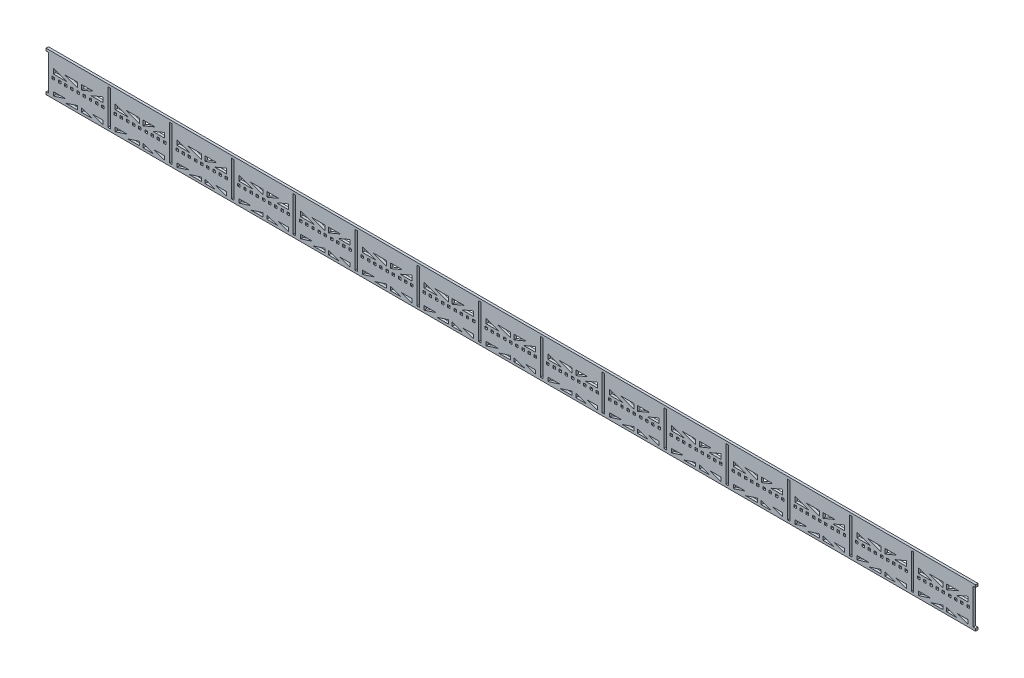
from build123d import *

# Parameters (mm, degrees)
BOSS_EXTRUDE1_DEPTH = 4
BOSS_EXTRUDE2_START = -4
BOSS_EXTRUDE2_DEPTH = 4
SKETCH5_W           = 4
SKETCH5_H           = 4
CUT_EXTRUDE1_DEPTH  = 10


# Read off the part's stored shape, not the designer's step: Boss-Extrude1
with BuildPart() as part:
    # Boss-Extrude1 outline → Boss-Extrude1 (new body)
    with BuildSketch(Plane.XY):
        Polygon((721.508397322, 1.805025961), (721.508397322, 40.020025961), (725.508397322, 40.020025961), (725.508397322, 44.020025961), (-778.491602678, 44.020025961), (-778.491602678, 40.020025961), (-774.491602678, 40.020025961), (-774.491602678, 1.805025961), (-750.491602678, 1.805025961), (-756.491602678, 9.805025961), (-732.491602678, 9.805025961), (-738.491602678, 1.805025961), (-714.491602678, 1.805025961), (-720.491602678, 9.805025961), (-696.491602678, 9.805025961), (-702.491602678, 1.805025961), (-678.491602678, 1.805025961), (-678.491602678, 40.020025961), (-674.491602678, 40.020025961), (-674.491602678, 1.805025961), (-650.491602678, 1.805025961), (-656.491602678, 9.805025961), (-632.491602678, 9.805025961), (-638.491602678, 1.805025961), (-614.491602678, 1.805025961), (-620.491602678, 9.805025961), (-596.491602678, 9.805025961), (-602.491602678, 1.805025961), (-578.491602678, 1.805025961), (-578.491602678, 40.020025961), (-574.491602678, 40.020025961), (-574.491602678, 1.805025961), (-550.491602678, 1.805025961), (-556.491602678, 9.805025961), (-532.491602678, 9.805025961), (-538.491602678, 1.805025961), (-514.491602678, 1.805025961), (-520.491602678, 9.805025961), (-496.491602678, 9.805025961), (-502.491602678, 1.805025961), (-478.491602678, 1.805025961), (-478.491602678, 40.020025961), (-474.491602678, 40.020025961), (-474.491602678, 1.805025961), (-450.491602678, 1.805025961), (-456.491602678, 9.805025961), (-432.491602678, 9.805025961), (-438.491602678, 1.805025961), (-414.491602678, 1.805025961), (-420.491602678, 9.805025961), (-396.491602678, 9.805025961), (-402.491602678, 1.805025961), (-378.491602678, 1.805025961), (-378.491602678, 40.020025961), (-374.491602678, 40.020025961), (-374.491602678, 1.805025961), (-350.491602678, 1.805025961), (-356.491602678, 9.805025961), (-332.491602678, 9.805025961), (-338.491602678, 1.805025961), (-314.491602678, 1.805025961), (-320.491602678, 9.805025961), (-296.491602678, 9.805025961), (-302.491602678, 1.805025961), (-278.491602678, 1.805025961), (-278.491602678, 40.020025961), (-274.491602678, 40.020025961), (-274.491602678, 1.805025961), (-250.491602678, 1.805025961), (-256.491602678, 9.805025961), (-232.491602678, 9.805025961), (-238.491602678, 1.805025961), (-214.491602678, 1.805025961), (-220.491602678, 9.805025961), (-196.491602678, 9.805025961), (-202.491602678, 1.805025961), (-178.491602678, 1.805025961), (-178.491602678, 40.020025961), (-174.491602678, 40.020025961), (-174.491602678, 1.805025961), (-150.491602678, 1.805025961), (-156.491602678, 9.805025961), (-132.491602678, 9.805025961), (-138.491602678, 1.805025961), (-114.491602678, 1.805025961), (-120.491602678, 9.805025961), (-96.491602678, 9.805025961), (-102.491602678, 1.805025961), (-78.491602678, 1.805025961), (-78.491602678, 40.020025961), (-74.491602678, 40.020025961), (-74.491602678, 1.805025961), (-50.491602678, 1.805025961), (-56.491602678, 9.805025961), (-32.491602678, 9.805025961), (-38.491602678, 1.805025961), (-14.491602678, 1.805025961), (-20.491602678, 9.805025961), (3.508397322, 9.805025961), (-2.491602678, 1.805025961), (21.508397322, 1.805025961), (21.508397322, 40.020025961), (25.508397322, 40.020025961), (25.508397322, 1.805025961), (49.508397322, 1.805025961), (43.508397322, 9.805025961), (67.508397322, 9.805025961), (61.508397322, 1.805025961), (85.508397322, 1.805025961), (79.508397322, 9.805025961), (103.508397322, 9.805025961), (97.508397322, 1.805025961), (121.508397322, 1.805025961), (121.508397322, 40.020025961), (125.508397322, 40.020025961), (125.508397322, 1.805025961), (149.508397322, 1.805025961), (143.508397322, 9.805025961), (167.508397322, 9.805025961), (161.508397322, 1.805025961), (185.508397322, 1.805025961), (179.508397322, 9.805025961), (203.508397322, 9.805025961), (197.508397322, 1.805025961), (221.508397322, 1.805025961), (221.508397322, 40.020025961), (225.508397322, 40.020025961), (225.508397322, 1.805025961), (249.508397322, 1.805025961), (243.508397322, 9.805025961), (267.508397322, 9.805025961), (261.508397322, 1.805025961), (285.508397322, 1.805025961), (279.508397322, 9.805025961), (303.508397322, 9.805025961), (297.508397322, 1.805025961), (321.508397322, 1.805025961), (321.508397322, 40.020025961), (325.508397322, 40.020025961), (325.508397322, 1.805025961), (349.508397322, 1.805025961), (343.508397322, 9.805025961), (367.508397322, 9.805025961), (361.508397322, 1.805025961), (385.508397322, 1.805025961), (379.508397322, 9.805025961), (403.508397322, 9.805025961), (397.508397322, 1.805025961), (421.508397322, 1.805025961), (421.508397322, 40.020025961), (425.508397322, 40.020025961), (425.508397322, 1.805025961), (449.508397322, 1.805025961), (443.508397322, 9.805025961), (467.508397322, 9.805025961), (461.508397322, 1.805025961), (485.508397322, 1.805025961), (479.508397322, 9.805025961), (503.508397322, 9.805025961), (497.508397322, 1.805025961), (521.508397322, 1.805025961), (521.508397322, 40.020025961), (525.508397322, 40.020025961), (525.508397322, 1.805025961), (549.508397322, 1.805025961), (543.508397322, 9.805025961), (567.508397322, 9.805025961), (561.508397322, 1.805025961), (585.508397322, 1.805025961), (579.508397322, 9.805025961), (603.508397322, 9.805025961), (597.508397322, 1.805025961), (621.508397322, 1.805025961), (621.508397322, 40.020025961), (625.508397322, 40.020025961), (625.508397322, 1.805025961), (649.508397322, 1.805025961), (643.508397322, 9.805025961), (667.508397322, 9.805025961), (661.508397322, 1.805025961), (685.508397322, 1.805025961), (679.508397322, 9.805025961), (703.508397322, 9.805025961), (697.508397322, 1.805025961), align=None)
    extrude(amount=BOSS_EXTRUDE1_DEPTH)

    # Sketch3 → Boss-Extrude2 (add)
    with BuildSketch(Plane.XY.offset(4).offset(BOSS_EXTRUDE2_START)):
        Polygon((-774.491602678, 1.805025961), (-774.491602678, -17.134974039), (-778.491602678, -17.134974039), (-778.491602678, -21.134974039), (725.508397322, -21.134974039), (725.508397322, -17.134974039), (721.508397322, -17.134974039), (721.508397322, 1.805025961), (697.508397322, 1.805025961), (703.508397322, 9.805025961), (679.508397322, 9.805025961), (685.508397322, 1.805025961), (661.508397322, 1.805025961), (667.508397322, 9.805025961), (643.508397322, 9.805025961), (649.508397322, 1.805025961), (625.508397322, 1.805025961), (625.508397322, -17.134974039), (621.508397322, -17.134974039), (621.508397322, 1.805025961), (597.508397322, 1.805025961), (603.508397322, 9.805025961), (579.508397322, 9.805025961), (585.508397322, 1.805025961), (561.508397322, 1.805025961), (567.508397322, 9.805025961), (543.508397322, 9.805025961), (549.508397322, 1.805025961), (525.508397322, 1.805025961), (525.508397322, -17.134974039), (521.508397322, -17.134974039), (521.508397322, 1.805025961), (497.508397322, 1.805025961), (503.508397322, 9.805025961), (479.508397322, 9.805025961), (485.508397322, 1.805025961), (461.508397322, 1.805025961), (467.508397322, 9.805025961), (443.508397322, 9.805025961), (449.508397322, 1.805025961), (425.508397322, 1.805025961), (425.508397322, -17.134974039), (421.508397322, -17.134974039), (421.508397322, 1.805025961), (397.508397322, 1.805025961), (403.508397322, 9.805025961), (379.508397322, 9.805025961), (385.508397322, 1.805025961), (361.508397322, 1.805025961), (367.508397322, 9.805025961), (343.508397322, 9.805025961), (349.508397322, 1.805025961), (325.508397322, 1.805025961), (325.508397322, -17.134974039), (321.508397322, -17.134974039), (321.508397322, 1.805025961), (297.508397322, 1.805025961), (303.508397322, 9.805025961), (279.508397322, 9.805025961), (285.508397322, 1.805025961), (261.508397322, 1.805025961), (267.508397322, 9.805025961), (243.508397322, 9.805025961), (249.508397322, 1.805025961), (225.508397322, 1.805025961), (225.508397322, -17.134974039), (221.508397322, -17.134974039), (221.508397322, 1.805025961), (197.508397322, 1.805025961), (203.508397322, 9.805025961), (179.508397322, 9.805025961), (185.508397322, 1.805025961), (161.508397322, 1.805025961), (167.508397322, 9.805025961), (143.508397322, 9.805025961), (149.508397322, 1.805025961), (125.508397322, 1.805025961), (125.508397322, -17.134974039), (121.508397322, -17.134974039), (121.508397322, 1.805025961), (97.508397322, 1.805025961), (103.508397322, 9.805025961), (79.508397322, 9.805025961), (85.508397322, 1.805025961), (61.508397322, 1.805025961), (67.508397322, 9.805025961), (43.508397322, 9.805025961), (49.508397322, 1.805025961), (25.508397322, 1.805025961), (25.508397322, -17.134974039), (21.508397322, -17.134974039), (21.508397322, 1.805025961), (-2.491602678, 1.805025961), (3.508397322, 9.805025961), (-20.491602678, 9.805025961), (-14.491602678, 1.805025961), (-38.491602678, 1.805025961), (-32.491602678, 9.805025961), (-56.491602678, 9.805025961), (-50.491602678, 1.805025961), (-74.491602678, 1.805025961), (-74.491602678, -17.134974039), (-78.491602678, -17.134974039), (-78.491602678, 1.805025961), (-102.491602678, 1.805025961), (-96.491602678, 9.805025961), (-120.491602678, 9.805025961), (-114.491602678, 1.805025961), (-138.491602678, 1.805025961), (-132.491602678, 9.805025961), (-156.491602678, 9.805025961), (-150.491602678, 1.805025961), (-174.491602678, 1.805025961), (-174.491602678, -17.134974039), (-178.491602678, -17.134974039), (-178.491602678, 1.805025961), (-202.491602678, 1.805025961), (-196.491602678, 9.805025961), (-220.491602678, 9.805025961), (-214.491602678, 1.805025961), (-238.491602678, 1.805025961), (-232.491602678, 9.805025961), (-256.491602678, 9.805025961), (-250.491602678, 1.805025961), (-274.491602678, 1.805025961), (-274.491602678, -17.134974039), (-278.491602678, -17.134974039), (-278.491602678, 1.805025961), (-302.491602678, 1.805025961), (-296.491602678, 9.805025961), (-320.491602678, 9.805025961), (-314.491602678, 1.805025961), (-338.491602678, 1.805025961), (-332.491602678, 9.805025961), (-356.491602678, 9.805025961), (-350.491602678, 1.805025961), (-374.491602678, 1.805025961), (-374.491602678, -17.134974039), (-378.491602678, -17.134974039), (-378.491602678, 1.805025961), (-402.491602678, 1.805025961), (-396.491602678, 9.805025961), (-420.491602678, 9.805025961), (-414.491602678, 1.805025961), (-438.491602678, 1.805025961), (-432.491602678, 9.805025961), (-456.491602678, 9.805025961), (-450.491602678, 1.805025961), (-474.491602678, 1.805025961), (-474.491602678, -17.134974039), (-478.491602678, -17.134974039), (-478.491602678, 1.805025961), (-502.491602678, 1.805025961), (-496.491602678, 9.805025961), (-520.491602678, 9.805025961), (-514.491602678, 1.805025961), (-538.491602678, 1.805025961), (-532.491602678, 9.805025961), (-556.491602678, 9.805025961), (-550.491602678, 1.805025961), (-574.491602678, 1.805025961), (-574.491602678, -17.134974039), (-578.491602678, -17.134974039), (-578.491602678, 1.805025961), (-602.491602678, 1.805025961), (-596.491602678, 9.805025961), (-620.491602678, 9.805025961), (-614.491602678, 1.805025961), (-638.491602678, 1.805025961), (-632.491602678, 9.805025961), (-656.491602678, 9.805025961), (-650.491602678, 1.805025961), (-674.491602678, 1.805025961), (-674.491602678, -17.134974039), (-678.491602678, -17.134974039), (-678.491602678, 1.805025961), (-702.491602678, 1.805025961), (-696.491602678, 9.805025961), (-720.491602678, 9.805025961), (-714.491602678, 1.805025961), (-738.491602678, 1.805025961), (-732.491602678, 9.805025961), (-756.491602678, 9.805025961), (-750.491602678, 1.805025961), align=None)
    extrude(amount=BOSS_EXTRUDE2_DEPTH)

    # Sketch5 → Cut-Extrude1 (cut)
    with BuildSketch(Plane.XY.offset(4)):
        Polygon((-666.491602678, 21.805025961), (-666.491602678, 13.805025961), (-644.636037004, 13.805025961), align=None)
        Polygon((-766.491602678, 21.805025961), (-766.491602678, 13.805025961), (-744.636037004, 13.805025961), align=None)
        Polygon((-749.036317378, 21.805025961), (-727.180751703, 13.805025961), (-727.180751703, 21.805025961), align=None)
        Polygon((-721.180751703, 21.805025961), (-721.180751703, 13.805025961), (-702.046261335, 21.805025961), align=None)
        Polygon((-686.491602678, 21.805025961), (-686.491602678, 13.805025961), (-705.626093047, 13.805025961), align=None)
        Polygon((-703.629058117, -10.924974039), (-686.491602678, -17.134974039), (-686.491602678, -10.924974039), align=None)
        Polygon((-704.103103987, -17.134974039), (-721.240559425, -17.134974039), (-721.240559425, -10.924974039), align=None)
        Polygon((-727.240559425, -17.134974039), (-746.729180991, -17.134974039), (-727.240559425, -10.924974039), align=None)
        Polygon((-747.002981113, -10.924974039), (-766.491602678, -17.134974039), (-766.491602678, -10.924974039), align=None)
        Polygon((-649.036317378, 21.805025961), (-627.180751703, 13.805025961), (-627.180751703, 21.805025961), align=None)
        Polygon((-621.180751703, 21.805025961), (-621.180751703, 13.805025961), (-602.046261335, 21.805025961), align=None)
        Polygon((-586.491602678, 21.805025961), (-586.491602678, 13.805025961), (-605.626093047, 13.805025961), align=None)
        Polygon((-603.629058117, -10.924974039), (-586.491602678, -17.134974039), (-586.491602678, -10.924974039), align=None)
        Polygon((-604.103103987, -17.134974039), (-621.240559425, -17.134974039), (-621.240559425, -10.924974039), align=None)
        Polygon((-627.240559425, -17.134974039), (-646.729180991, -17.134974039), (-627.240559425, -10.924974039), align=None)
        Polygon((-647.002981113, -10.924974039), (-666.491602678, -17.134974039), (-666.491602678, -10.924974039), align=None)
        with Locations((-666.491602678, 7.755025961)):
            Rectangle(SKETCH5_W, SKETCH5_H)
        with Locations((-656.491602678, 7.755025961)):
            Rectangle(SKETCH5_W, SKETCH5_H)
        with Locations((-646.491602678, 7.755025961)):
            Rectangle(SKETCH5_W, SKETCH5_H)
        with Locations((-636.491602678, 7.755025961)):
            Rectangle(SKETCH5_W, SKETCH5_H)
        with Locations((-626.491602678, 7.755025961)):
            Rectangle(SKETCH5_W, SKETCH5_H)
        with Locations((-616.491602678, 7.755025961)):
            Rectangle(SKETCH5_W, SKETCH5_H)
        with Locations((-606.491602678, 7.755025961)):
            Rectangle(SKETCH5_W, SKETCH5_H)
        with Locations((-596.491602678, 7.755025961)):
            Rectangle(SKETCH5_W, SKETCH5_H)
        with Locations((-586.491602678, 7.755025961)):
            Rectangle(SKETCH5_W, SKETCH5_H)
        with Locations((-566.491602678, 7.755025961)):
            Rectangle(SKETCH5_W, SKETCH5_H)
        with Locations((-556.491602678, 7.755025961)):
            Rectangle(SKETCH5_W, SKETCH5_H)
        Polygon((-566.491602678, 21.805025961), (-566.491602678, 13.805025961), (-544.636037004, 13.805025961), align=None)
        Polygon((-549.036317378, 21.805025961), (-527.180751703, 13.805025961), (-527.180751703, 21.805025961), align=None)
        Polygon((-521.180751703, 21.805025961), (-521.180751703, 13.805025961), (-502.046261335, 21.805025961), align=None)
        Polygon((-486.491602678, 21.805025961), (-486.491602678, 13.805025961), (-505.626093047, 13.805025961), align=None)
        Polygon((-503.629058117, -10.924974039), (-486.491602678, -17.134974039), (-486.491602678, -10.924974039), align=None)
        Polygon((-504.103103987, -17.134974039), (-521.240559425, -17.134974039), (-521.240559425, -10.924974039), align=None)
        Polygon((-527.240559425, -17.134974039), (-546.729180991, -17.134974039), (-527.240559425, -10.924974039), align=None)
        Polygon((-547.002981113, -10.924974039), (-566.491602678, -17.134974039), (-566.491602678, -10.924974039), align=None)
        with Locations((-546.491602678, 7.755025961)):
            Rectangle(SKETCH5_W, SKETCH5_H)
        with Locations((-536.491602678, 7.755025961)):
            Rectangle(SKETCH5_W, SKETCH5_H)
        with Locations((-526.491602678, 7.755025961)):
            Rectangle(SKETCH5_W, SKETCH5_H)
        with Locations((-516.491602678, 7.755025961)):
            Rectangle(SKETCH5_W, SKETCH5_H)
        with Locations((-506.491602678, 7.755025961)):
            Rectangle(SKETCH5_W, SKETCH5_H)
        with Locations((-496.491602678, 7.755025961)):
            Rectangle(SKETCH5_W, SKETCH5_H)
        with Locations((-486.491602678, 7.755025961)):
            Rectangle(SKETCH5_W, SKETCH5_H)
        with Locations((-466.491602678, 7.755025961)):
            Rectangle(SKETCH5_W, SKETCH5_H)
        with Locations((-456.491602678, 7.755025961)):
            Rectangle(SKETCH5_W, SKETCH5_H)
        with Locations((-446.491602678, 7.755025961)):
            Rectangle(SKETCH5_W, SKETCH5_H)
        with Locations((-436.491602678, 7.755025961)):
            Rectangle(SKETCH5_W, SKETCH5_H)
        Polygon((-466.491602678, 21.805025961), (-466.491602678, 13.805025961), (-444.636037004, 13.805025961), align=None)
        Polygon((-449.036317378, 21.805025961), (-427.180751703, 13.805025961), (-427.180751703, 21.805025961), align=None)
        Polygon((-421.180751703, 21.805025961), (-421.180751703, 13.805025961), (-402.046261335, 21.805025961), align=None)
        Polygon((-386.491602678, 21.805025961), (-386.491602678, 13.805025961), (-405.626093047, 13.805025961), align=None)
        Polygon((-403.629058117, -10.924974039), (-386.491602678, -17.134974039), (-386.491602678, -10.924974039), align=None)
        Polygon((-404.103103987, -17.134974039), (-421.240559425, -17.134974039), (-421.240559425, -10.924974039), align=None)
        Polygon((-427.240559425, -17.134974039), (-446.729180991, -17.134974039), (-427.240559425, -10.924974039), align=None)
        Polygon((-447.002981113, -10.924974039), (-466.491602678, -17.134974039), (-466.491602678, -10.924974039), align=None)
        with Locations((-426.491602678, 7.755025961)):
            Rectangle(SKETCH5_W, SKETCH5_H)
        with Locations((-416.491602678, 7.755025961)):
            Rectangle(SKETCH5_W, SKETCH5_H)
        with Locations((-406.491602678, 7.755025961)):
            Rectangle(SKETCH5_W, SKETCH5_H)
        with Locations((-396.491602678, 7.755025961)):
            Rectangle(SKETCH5_W, SKETCH5_H)
        with Locations((-386.491602678, 7.755025961)):
            Rectangle(SKETCH5_W, SKETCH5_H)
        with Locations((-366.491602678, 7.755025961)):
            Rectangle(SKETCH5_W, SKETCH5_H)
        with Locations((-356.491602678, 7.755025961)):
            Rectangle(SKETCH5_W, SKETCH5_H)
        with Locations((-346.491602678, 7.755025961)):
            Rectangle(SKETCH5_W, SKETCH5_H)
        with Locations((-336.491602678, 7.755025961)):
            Rectangle(SKETCH5_W, SKETCH5_H)
        with Locations((-326.491602678, 7.755025961)):
            Rectangle(SKETCH5_W, SKETCH5_H)
        with Locations((-316.491602678, 7.755025961)):
            Rectangle(SKETCH5_W, SKETCH5_H)
        Polygon((-366.491602678, 21.805025961), (-366.491602678, 13.805025961), (-344.636037004, 13.805025961), align=None)
        Polygon((-349.036317378, 21.805025961), (-327.180751703, 13.805025961), (-327.180751703, 21.805025961), align=None)
        Polygon((-321.180751703, 21.805025961), (-321.180751703, 13.805025961), (-302.046261335, 21.805025961), align=None)
        Polygon((-286.491602678, 21.805025961), (-286.491602678, 13.805025961), (-305.626093047, 13.805025961), align=None)
        Polygon((-303.629058117, -10.924974039), (-286.491602678, -17.134974039), (-286.491602678, -10.924974039), align=None)
        Polygon((-304.103103987, -17.134974039), (-321.240559425, -17.134974039), (-321.240559425, -10.924974039), align=None)
        Polygon((-327.240559425, -17.134974039), (-346.729180991, -17.134974039), (-327.240559425, -10.924974039), align=None)
        Polygon((-347.002981113, -10.924974039), (-366.491602678, -17.134974039), (-366.491602678, -10.924974039), align=None)
        with Locations((-306.491602678, 7.755025961)):
            Rectangle(SKETCH5_W, SKETCH5_H)
        with Locations((-296.491602678, 7.755025961)):
            Rectangle(SKETCH5_W, SKETCH5_H)
        with Locations((-286.491602678, 7.755025961)):
            Rectangle(SKETCH5_W, SKETCH5_H)
        with Locations((-266.491602678, 7.755025961)):
            Rectangle(SKETCH5_W, SKETCH5_H)
        with Locations((-256.491602678, 7.755025961)):
            Rectangle(SKETCH5_W, SKETCH5_H)
        with Locations((-246.491602678, 7.755025961)):
            Rectangle(SKETCH5_W, SKETCH5_H)
        with Locations((-236.491602678, 7.755025961)):
            Rectangle(SKETCH5_W, SKETCH5_H)
        with Locations((-226.491602678, 7.755025961)):
            Rectangle(SKETCH5_W, SKETCH5_H)
        with Locations((-216.491602678, 7.755025961)):
            Rectangle(SKETCH5_W, SKETCH5_H)
        with Locations((-206.491602678, 7.755025961)):
            Rectangle(SKETCH5_W, SKETCH5_H)
        with Locations((-196.491602678, 7.755025961)):
            Rectangle(SKETCH5_W, SKETCH5_H)
        Polygon((-266.491602678, 21.805025961), (-266.491602678, 13.805025961), (-244.636037004, 13.805025961), align=None)
        Polygon((-249.036317378, 21.805025961), (-227.180751703, 13.805025961), (-227.180751703, 21.805025961), align=None)
        Polygon((-221.180751703, 21.805025961), (-221.180751703, 13.805025961), (-202.046261335, 21.805025961), align=None)
        Polygon((-186.491602678, 21.805025961), (-186.491602678, 13.805025961), (-205.626093047, 13.805025961), align=None)
        Polygon((-203.629058117, -10.924974039), (-186.491602678, -17.134974039), (-186.491602678, -10.924974039), align=None)
        Polygon((-204.103103987, -17.134974039), (-221.240559425, -17.134974039), (-221.240559425, -10.924974039), align=None)
        Polygon((-227.240559425, -17.134974039), (-246.729180991, -17.134974039), (-227.240559425, -10.924974039), align=None)
        Polygon((-247.002981113, -10.924974039), (-266.491602678, -17.134974039), (-266.491602678, -10.924974039), align=None)
        with Locations((-186.491602678, 7.755025961)):
            Rectangle(SKETCH5_W, SKETCH5_H)
        with Locations((-166.491602678, 7.755025961)):
            Rectangle(SKETCH5_W, SKETCH5_H)
        with Locations((-156.491602678, 7.755025961)):
            Rectangle(SKETCH5_W, SKETCH5_H)
        with Locations((-146.491602678, 7.755025961)):
            Rectangle(SKETCH5_W, SKETCH5_H)
        with Locations((-136.491602678, 7.755025961)):
            Rectangle(SKETCH5_W, SKETCH5_H)
        with Locations((-126.491602678, 7.755025961)):
            Rectangle(SKETCH5_W, SKETCH5_H)
        with Locations((-116.491602678, 7.755025961)):
            Rectangle(SKETCH5_W, SKETCH5_H)
        with Locations((-106.491602678, 7.755025961)):
            Rectangle(SKETCH5_W, SKETCH5_H)
        with Locations((-96.491602678, 7.755025961)):
            Rectangle(SKETCH5_W, SKETCH5_H)
        with Locations((-86.491602678, 7.755025961)):
            Rectangle(SKETCH5_W, SKETCH5_H)
        with Locations((-766.491602678, 7.755025961)):
            Rectangle(SKETCH5_W, SKETCH5_H)
        with Locations((-756.491602678, 7.755025961)):
            Rectangle(SKETCH5_W, SKETCH5_H)
        with Locations((-746.491602678, 7.755025961)):
            Rectangle(SKETCH5_W, SKETCH5_H)
        with Locations((-736.491602678, 7.755025961)):
            Rectangle(SKETCH5_W, SKETCH5_H)
        with Locations((-726.491602678, 7.755025961)):
            Rectangle(SKETCH5_W, SKETCH5_H)
        with Locations((-716.491602678, 7.755025961)):
            Rectangle(SKETCH5_W, SKETCH5_H)
        with Locations((-706.491602678, 7.755025961)):
            Rectangle(SKETCH5_W, SKETCH5_H)
        with Locations((-696.491602678, 7.755025961)):
            Rectangle(SKETCH5_W, SKETCH5_H)
        with Locations((-686.491602678, 7.755025961)):
            Rectangle(SKETCH5_W, SKETCH5_H)
        with Locations((-66.491602678, 7.755025961)):
            Rectangle(SKETCH5_W, SKETCH5_H)
        with Locations((-56.491602678, 7.755025961)):
            Rectangle(SKETCH5_W, SKETCH5_H)
        with Locations((-46.491602678, 7.755025961)):
            Rectangle(SKETCH5_W, SKETCH5_H)
        Polygon((-166.491602678, 21.805025961), (-166.491602678, 13.805025961), (-144.636037004, 13.805025961), align=None)
        Polygon((-149.036317378, 21.805025961), (-127.180751703, 13.805025961), (-127.180751703, 21.805025961), align=None)
        Polygon((-121.180751703, 21.805025961), (-121.180751703, 13.805025961), (-102.046261335, 21.805025961), align=None)
        Polygon((-86.491602678, 21.805025961), (-86.491602678, 13.805025961), (-105.626093047, 13.805025961), align=None)
        Polygon((-103.629058117, -10.924974039), (-86.491602678, -17.134974039), (-86.491602678, -10.924974039), align=None)
        Polygon((-104.103103987, -17.134974039), (-121.240559425, -17.134974039), (-121.240559425, -10.924974039), align=None)
        Polygon((-127.240559425, -17.134974039), (-146.729180991, -17.134974039), (-127.240559425, -10.924974039), align=None)
        Polygon((-147.002981113, -10.924974039), (-166.491602678, -17.134974039), (-166.491602678, -10.924974039), align=None)
        with Locations((-36.491602678, 7.755025961)):
            Rectangle(SKETCH5_W, SKETCH5_H)
        with Locations((-26.491602678, 7.755025961)):
            Rectangle(SKETCH5_W, SKETCH5_H)
        with Locations((-16.491602678, 7.755025961)):
            Rectangle(SKETCH5_W, SKETCH5_H)
        with Locations((-6.491602678, 7.755025961)):
            Rectangle(SKETCH5_W, SKETCH5_H)
        with Locations((3.508397322, 7.755025961)):
            Rectangle(SKETCH5_W, SKETCH5_H)
        with Locations((13.508397322, 7.755025961)):
            Rectangle(SKETCH5_W, SKETCH5_H)
        with Locations((33.508397322, 7.755025961)):
            Rectangle(SKETCH5_W, SKETCH5_H)
        with Locations((43.508397322, 7.755025961)):
            Rectangle(SKETCH5_W, SKETCH5_H)
        with Locations((53.508397322, 7.755025961)):
            Rectangle(SKETCH5_W, SKETCH5_H)
        with Locations((63.508397322, 7.755025961)):
            Rectangle(SKETCH5_W, SKETCH5_H)
        with Locations((73.508397322, 7.755025961)):
            Rectangle(SKETCH5_W, SKETCH5_H)
        Polygon((-66.491602678, 21.805025961), (-66.491602678, 13.805025961), (-44.636037004, 13.805025961), align=None)
        Polygon((-49.036317378, 21.805025961), (-27.180751703, 13.805025961), (-27.180751703, 21.805025961), align=None)
        Polygon((-21.180751703, 21.805025961), (-21.180751703, 13.805025961), (-2.046261335, 21.805025961), align=None)
        Polygon((13.508397322, 21.805025961), (13.508397322, 13.805025961), (-5.626093047, 13.805025961), align=None)
        Polygon((-3.629058117, -10.924974039), (13.508397322, -17.134974039), (13.508397322, -10.924974039), align=None)
        Polygon((-4.103103987, -17.134974039), (-21.240559425, -17.134974039), (-21.240559425, -10.924974039), align=None)
        Polygon((-27.240559425, -17.134974039), (-46.729180991, -17.134974039), (-27.240559425, -10.924974039), align=None)
        Polygon((-47.002981113, -10.924974039), (-66.491602678, -17.134974039), (-66.491602678, -10.924974039), align=None)
        with Locations((83.508397322, 7.755025961)):
            Rectangle(SKETCH5_W, SKETCH5_H)
        with Locations((93.508397322, 7.755025961)):
            Rectangle(SKETCH5_W, SKETCH5_H)
        with Locations((103.508397322, 7.755025961)):
            Rectangle(SKETCH5_W, SKETCH5_H)
        with Locations((113.508397322, 7.755025961)):
            Rectangle(SKETCH5_W, SKETCH5_H)
        with Locations((133.508397322, 7.755025961)):
            Rectangle(SKETCH5_W, SKETCH5_H)
        with Locations((143.508397322, 7.755025961)):
            Rectangle(SKETCH5_W, SKETCH5_H)
        with Locations((153.508397322, 7.755025961)):
            Rectangle(SKETCH5_W, SKETCH5_H)
        with Locations((163.508397322, 7.755025961)):
            Rectangle(SKETCH5_W, SKETCH5_H)
        with Locations((173.508397322, 7.755025961)):
            Rectangle(SKETCH5_W, SKETCH5_H)
        with Locations((183.508397322, 7.755025961)):
            Rectangle(SKETCH5_W, SKETCH5_H)
        with Locations((193.508397322, 7.755025961)):
            Rectangle(SKETCH5_W, SKETCH5_H)
        Polygon((33.508397322, 21.805025961), (33.508397322, 13.805025961), (55.363962996, 13.805025961), align=None)
        Polygon((50.963682622, 21.805025961), (72.819248297, 13.805025961), (72.819248297, 21.805025961), align=None)
        Polygon((78.819248297, 21.805025961), (78.819248297, 13.805025961), (97.953738665, 21.805025961), align=None)
        Polygon((113.508397322, 21.805025961), (113.508397322, 13.805025961), (94.373906953, 13.805025961), align=None)
        Polygon((96.370941883, -10.924974039), (113.508397322, -17.134974039), (113.508397322, -10.924974039), align=None)
        Polygon((95.896896013, -17.134974039), (78.759440575, -17.134974039), (78.759440575, -10.924974039), align=None)
        Polygon((72.759440575, -17.134974039), (53.270819009, -17.134974039), (72.759440575, -10.924974039), align=None)
        Polygon((52.997018887, -10.924974039), (33.508397322, -17.134974039), (33.508397322, -10.924974039), align=None)
        with Locations((203.508397322, 7.755025961)):
            Rectangle(SKETCH5_W, SKETCH5_H)
        with Locations((213.508397322, 7.755025961)):
            Rectangle(SKETCH5_W, SKETCH5_H)
        with Locations((233.508397322, 7.755025961)):
            Rectangle(SKETCH5_W, SKETCH5_H)
        with Locations((243.508397322, 7.755025961)):
            Rectangle(SKETCH5_W, SKETCH5_H)
        with Locations((253.508397322, 7.755025961)):
            Rectangle(SKETCH5_W, SKETCH5_H)
        with Locations((263.508397322, 7.755025961)):
            Rectangle(SKETCH5_W, SKETCH5_H)
        with Locations((273.508397322, 7.755025961)):
            Rectangle(SKETCH5_W, SKETCH5_H)
        with Locations((283.508397322, 7.755025961)):
            Rectangle(SKETCH5_W, SKETCH5_H)
        with Locations((293.508397322, 7.755025961)):
            Rectangle(SKETCH5_W, SKETCH5_H)
        with Locations((303.508397322, 7.755025961)):
            Rectangle(SKETCH5_W, SKETCH5_H)
        with Locations((313.508397322, 7.755025961)):
            Rectangle(SKETCH5_W, SKETCH5_H)
        Polygon((133.508397322, 21.805025961), (133.508397322, 13.805025961), (155.363962996, 13.805025961), align=None)
        Polygon((150.963682622, 21.805025961), (172.819248297, 13.805025961), (172.819248297, 21.805025961), align=None)
        Polygon((178.819248297, 21.805025961), (178.819248297, 13.805025961), (197.953738665, 21.805025961), align=None)
        Polygon((213.508397322, 21.805025961), (213.508397322, 13.805025961), (194.373906953, 13.805025961), align=None)
        Polygon((196.370941883, -10.924974039), (213.508397322, -17.134974039), (213.508397322, -10.924974039), align=None)
        Polygon((195.896896013, -17.134974039), (178.759440575, -17.134974039), (178.759440575, -10.924974039), align=None)
        Polygon((172.759440575, -17.134974039), (153.270819009, -17.134974039), (172.759440575, -10.924974039), align=None)
        Polygon((152.997018887, -10.924974039), (133.508397322, -17.134974039), (133.508397322, -10.924974039), align=None)
        with Locations((333.508397322, 7.755025961)):
            Rectangle(SKETCH5_W, SKETCH5_H)
        with Locations((343.508397322, 7.755025961)):
            Rectangle(SKETCH5_W, SKETCH5_H)
        with Locations((353.508397322, 7.755025961)):
            Rectangle(SKETCH5_W, SKETCH5_H)
        with Locations((363.508397322, 7.755025961)):
            Rectangle(SKETCH5_W, SKETCH5_H)
        with Locations((373.508397322, 7.755025961)):
            Rectangle(SKETCH5_W, SKETCH5_H)
        with Locations((383.508397322, 7.755025961)):
            Rectangle(SKETCH5_W, SKETCH5_H)
        with Locations((393.508397322, 7.755025961)):
            Rectangle(SKETCH5_W, SKETCH5_H)
        with Locations((403.508397322, 7.755025961)):
            Rectangle(SKETCH5_W, SKETCH5_H)
        with Locations((413.508397322, 7.755025961)):
            Rectangle(SKETCH5_W, SKETCH5_H)
        with Locations((433.508397322, 7.755025961)):
            Rectangle(SKETCH5_W, SKETCH5_H)
        with Locations((443.508397322, 7.755025961)):
            Rectangle(SKETCH5_W, SKETCH5_H)
        Polygon((233.508397322, 21.805025961), (233.508397322, 13.805025961), (255.363962996, 13.805025961), align=None)
        Polygon((250.963682622, 21.805025961), (272.819248297, 13.805025961), (272.819248297, 21.805025961), align=None)
        Polygon((278.819248297, 21.805025961), (278.819248297, 13.805025961), (297.953738665, 21.805025961), align=None)
        Polygon((313.508397322, 21.805025961), (313.508397322, 13.805025961), (294.373906953, 13.805025961), align=None)
        Polygon((296.370941883, -10.924974039), (313.508397322, -17.134974039), (313.508397322, -10.924974039), align=None)
        Polygon((295.896896013, -17.134974039), (278.759440575, -17.134974039), (278.759440575, -10.924974039), align=None)
        Polygon((272.759440575, -17.134974039), (253.270819009, -17.134974039), (272.759440575, -10.924974039), align=None)
        Polygon((252.997018887, -10.924974039), (233.508397322, -17.134974039), (233.508397322, -10.924974039), align=None)
        with Locations((453.508397322, 7.755025961)):
            Rectangle(SKETCH5_W, SKETCH5_H)
        with Locations((463.508397322, 7.755025961)):
            Rectangle(SKETCH5_W, SKETCH5_H)
        with Locations((473.508397322, 7.755025961)):
            Rectangle(SKETCH5_W, SKETCH5_H)
        with Locations((483.508397322, 7.755025961)):
            Rectangle(SKETCH5_W, SKETCH5_H)
        with Locations((493.508397322, 7.755025961)):
            Rectangle(SKETCH5_W, SKETCH5_H)
        with Locations((503.508397322, 7.755025961)):
            Rectangle(SKETCH5_W, SKETCH5_H)
        with Locations((513.508397322, 7.755025961)):
            Rectangle(SKETCH5_W, SKETCH5_H)
        with Locations((533.508397322, 7.755025961)):
            Rectangle(SKETCH5_W, SKETCH5_H)
        with Locations((543.508397322, 7.755025961)):
            Rectangle(SKETCH5_W, SKETCH5_H)
        with Locations((553.508397322, 7.755025961)):
            Rectangle(SKETCH5_W, SKETCH5_H)
        with Locations((563.508397322, 7.755025961)):
            Rectangle(SKETCH5_W, SKETCH5_H)
        Polygon((333.508397322, 21.805025961), (333.508397322, 13.805025961), (355.363962996, 13.805025961), align=None)
        Polygon((350.963682622, 21.805025961), (372.819248297, 13.805025961), (372.819248297, 21.805025961), align=None)
        Polygon((378.819248297, 21.805025961), (378.819248297, 13.805025961), (397.953738665, 21.805025961), align=None)
        Polygon((413.508397322, 21.805025961), (413.508397322, 13.805025961), (394.373906953, 13.805025961), align=None)
        Polygon((396.370941883, -10.924974039), (413.508397322, -17.134974039), (413.508397322, -10.924974039), align=None)
        Polygon((395.896896013, -17.134974039), (378.759440575, -17.134974039), (378.759440575, -10.924974039), align=None)
        Polygon((372.759440575, -17.134974039), (353.270819009, -17.134974039), (372.759440575, -10.924974039), align=None)
        Polygon((352.997018887, -10.924974039), (333.508397322, -17.134974039), (333.508397322, -10.924974039), align=None)
        with Locations((573.508397322, 7.755025961)):
            Rectangle(SKETCH5_W, SKETCH5_H)
        with Locations((583.508397322, 7.755025961)):
            Rectangle(SKETCH5_W, SKETCH5_H)
        with Locations((593.508397322, 7.755025961)):
            Rectangle(SKETCH5_W, SKETCH5_H)
        with Locations((603.508397322, 7.755025961)):
            Rectangle(SKETCH5_W, SKETCH5_H)
        with Locations((613.508397322, 7.755025961)):
            Rectangle(SKETCH5_W, SKETCH5_H)
        with Locations((633.508397322, 7.755025961)):
            Rectangle(SKETCH5_W, SKETCH5_H)
        with Locations((643.508397322, 7.755025961)):
            Rectangle(SKETCH5_W, SKETCH5_H)
        with Locations((653.508397322, 7.755025961)):
            Rectangle(SKETCH5_W, SKETCH5_H)
        with Locations((663.508397322, 7.755025961)):
            Rectangle(SKETCH5_W, SKETCH5_H)
        with Locations((673.508397322, 7.755025961)):
            Rectangle(SKETCH5_W, SKETCH5_H)
        with Locations((683.508397322, 7.755025961)):
            Rectangle(SKETCH5_W, SKETCH5_H)
        Polygon((433.508397322, 21.805025961), (433.508397322, 13.805025961), (455.363962996, 13.805025961), align=None)
        Polygon((450.963682622, 21.805025961), (472.819248297, 13.805025961), (472.819248297, 21.805025961), align=None)
        Polygon((478.819248297, 21.805025961), (478.819248297, 13.805025961), (497.953738665, 21.805025961), align=None)
        Polygon((513.508397322, 21.805025961), (513.508397322, 13.805025961), (494.373906953, 13.805025961), align=None)
        Polygon((496.370941883, -10.924974039), (513.508397322, -17.134974039), (513.508397322, -10.924974039), align=None)
        Polygon((495.896896013, -17.134974039), (478.759440575, -17.134974039), (478.759440575, -10.924974039), align=None)
        Polygon((472.759440575, -17.134974039), (453.270819009, -17.134974039), (472.759440575, -10.924974039), align=None)
        Polygon((452.997018887, -10.924974039), (433.508397322, -17.134974039), (433.508397322, -10.924974039), align=None)
        with Locations((693.508397322, 7.755025961)):
            Rectangle(SKETCH5_W, SKETCH5_H)
        with Locations((703.508397322, 7.755025961)):
            Rectangle(SKETCH5_W, SKETCH5_H)
        with Locations((713.508397322, 7.755025961)):
            Rectangle(SKETCH5_W, SKETCH5_H)
        Polygon((533.508397322, 21.805025961), (533.508397322, 13.805025961), (555.363962996, 13.805025961), align=None)
        Polygon((550.963682622, 21.805025961), (572.819248297, 13.805025961), (572.819248297, 21.805025961), align=None)
        Polygon((578.819248297, 21.805025961), (578.819248297, 13.805025961), (597.953738665, 21.805025961), align=None)
        Polygon((613.508397322, 21.805025961), (613.508397322, 13.805025961), (594.373906953, 13.805025961), align=None)
        Polygon((596.370941883, -10.924974039), (613.508397322, -17.134974039), (613.508397322, -10.924974039), align=None)
        Polygon((595.896896013, -17.134974039), (578.759440575, -17.134974039), (578.759440575, -10.924974039), align=None)
        Polygon((572.759440575, -17.134974039), (553.270819009, -17.134974039), (572.759440575, -10.924974039), align=None)
        Polygon((552.997018887, -10.924974039), (533.508397322, -17.134974039), (533.508397322, -10.924974039), align=None)
        Polygon((633.508397322, 21.805025961), (633.508397322, 13.805025961), (655.363962996, 13.805025961), align=None)
        Polygon((650.963682622, 21.805025961), (672.819248297, 13.805025961), (672.819248297, 21.805025961), align=None)
        Polygon((678.819248297, 21.805025961), (678.819248297, 13.805025961), (697.953738665, 21.805025961), align=None)
        Polygon((713.508397322, 21.805025961), (713.508397322, 13.805025961), (694.373906953, 13.805025961), align=None)
        Polygon((696.370941883, -10.924974039), (713.508397322, -17.134974039), (713.508397322, -10.924974039), align=None)
        Polygon((695.896896013, -17.134974039), (678.759440575, -17.134974039), (678.759440575, -10.924974039), align=None)
        Polygon((672.759440575, -17.134974039), (653.270819009, -17.134974039), (672.759440575, -10.924974039), align=None)
        Polygon((652.997018887, -10.924974039), (633.508397322, -17.134974039), (633.508397322, -10.924974039), align=None)
    extrude(amount=-CUT_EXTRUDE1_DEPTH, mode=Mode.SUBTRACT)


solid = part.part
